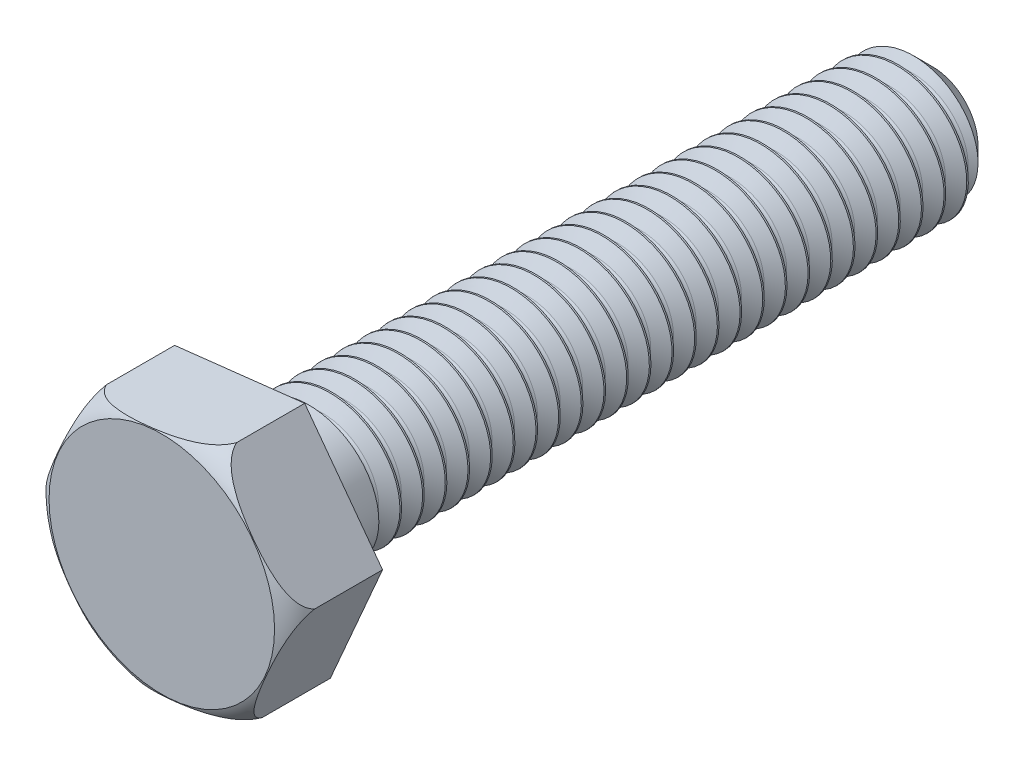
from build123d import *

# Parameters (mm, degrees)
SKETCH1_R           = 3
BOSS_EXTRUDE1_DEPTH = 30
CHAMFER1_SIZE       = 1
CUT_SWEEP1_PITCH    = 1
BOSS_EXTRUDE2_DEPTH = 4


with BuildPart() as part:
    # Sketch1 → Boss-Extrude1 (new body)
    with BuildSketch(Plane.XY):
        Circle(SKETCH1_R)
    extrude(amount=BOSS_EXTRUDE1_DEPTH)

    # Chamfer1
    chamfer1_edges = [part.edges().sort_by_distance(p)[0] for p in [
        (-3, 0, 0),
    ]]
    chamfer(chamfer1_edges, length=CHAMFER1_SIZE)

    # Cut-Sweep1: the profile of Sketch3 profile screwed along a right-hand helix of 27 turns, 8 arcs to a turn; built about Z, then put on its axis
    cut_sweep1_z = Axis((0, 0, 0), (0, 0, 1))
    cut_sweep1_corners = [(3.0003, 0, -0.000173205), (3.0003, 0, 0.930173205), (2.404596374, 0, 0.586243557), (2.334596374, 0, 0.465), (2.404596374, 0, 0.343756443)]
    with BuildLine(mode=Mode.PRIVATE) as cut_sweep1_profile:
        Line(cut_sweep1_corners[0], cut_sweep1_corners[1])
        Line(cut_sweep1_corners[1], cut_sweep1_corners[2])
        Line(cut_sweep1_corners[4], cut_sweep1_corners[0])
        ThreePointArc((2.404596374, 0, 0.586243557), (2.353352818, 0, 0.535), (2.334596374, 0, 0.465))
        ThreePointArc((2.334596374, 0, 0.465), (2.353352818, 0, 0.395), (2.404596374, 0, 0.343756443))
    cut_sweep1_cap = Face(cut_sweep1_profile.wire())
    cut_sweep1_arcs = [((2.404596374, 0, 0.586243557), (2.334596374, 0, 0.545829038), (2.334596374, 0, 0.465), (1, 0.8660254037844355, 1)), ((2.334596374, 0, 0.465), (2.334596374, 0, 0.384170962), (2.404596374, 0, 0.343756443), (1, 0.8660254037844355, 1))]  # start, shoulder, end, weights
    cut_sweep1_turn_angles = [0, 22.5, 45, 67.5, 90, 112.5, 135, 157.5, 180, 202.5, 225, 247.5, 270, 292.5, 315, 337.5, 360]
    cut_sweep1_turn_weights = [1, 0.9238795325112867, 1, 0.9238795325112867, 1, 0.9238795325112867, 1, 0.9238795325112867, 1, 0.9238795325112867, 1, 0.9238795325112867, 1, 0.9238795325112867, 1, 0.9238795325112867, 1]
    cut_sweep1_turn_rails = [Edge.make_bspline([Vector(p[0], p[1], 0).rotate(cut_sweep1_z, cut_sweep1_turn_angles[k]) / cut_sweep1_turn_weights[k] + Vector(0, 0, p[2] + CUT_SWEEP1_PITCH * cut_sweep1_turn_angles[k] / 360) for k in range(17)], [0, 0, 0, 1, 1, 2, 2, 3, 3, 4, 4, 5, 5, 6, 6, 7, 7, 8, 8, 8], 2, cut_sweep1_turn_weights) for p in cut_sweep1_corners]
    cut_sweep1_turn_sides = [*[Face.make_surface_from_curves(cut_sweep1_turn_rails[p[0]], cut_sweep1_turn_rails[p[1]]) for p in [(0, 1), (1, 2), (4, 0)]], *[Face.make_bezier_surface([[Vector(p[j][0], p[j][1], 0).rotate(cut_sweep1_z, cut_sweep1_turn_angles[2 * i + k]) / cut_sweep1_turn_weights[2 * i + k] + Vector(0, 0, p[j][2] + CUT_SWEEP1_PITCH * cut_sweep1_turn_angles[2 * i + k] / 360) for k in range(3)] for j in range(3)], [[p[3][j] * cut_sweep1_turn_weights[2 * i + k] for k in range(3)] for j in range(3)]) for p in cut_sweep1_arcs for i in range(8)]]
    cut_sweep1 = Plane(origin=(0, 0, 0), x_dir=(-1, 0, 0), z_dir=(0, 0, 1)) * Solid(Shell([*[p.moved(Location((0, 0, CUT_SWEEP1_PITCH * i))) for i in range(27) for p in cut_sweep1_turn_sides], cut_sweep1_cap, cut_sweep1_cap.rotate(cut_sweep1_z, 9720).moved(Location((0, 0, CUT_SWEEP1_PITCH * 9720 / 360)))]))
    add(cut_sweep1, mode=Mode.SUBTRACT)

    # Sketch4 → Boss-Extrude2 (add)
    with BuildSketch(Plane.XY.offset(30)):
        Polygon((-5.736404342, -0.653451264), (-2.302296776, -5.294597519), (3.434107566, -4.641146255), (5.736404342, 0.653451264), (2.302296776, 5.294597519), (-3.434107566, 4.641146255), align=None)
    extrude(amount=BOSS_EXTRUDE2_DEPTH)

    # Sketch7 → Cut-Revolve1 (revolve, cut)
    with BuildSketch(Plane(origin=(0, 0, 0), x_dir=(0.9935743773641322, 0.11318107900827326, 0), z_dir=(-0.11318107900827326, 0.9935743773641322, 0)), mode=Mode.PRIVATE) as cut_revolve1_sk:
        with BuildLine():
            Line((-5.773502692, -34), (-4.973502692, -34))
            add(Edge.make_bspline(
                [(-4.973502692, -34), (-5.616296389, -33.702579084), (-5.773502692, -33)],
                knots=[0, 0, 0, 1, 1, 1], degree=2))
            Line((-5.773502692, -33), (-5.773502692, -34))
        make_face()
    revolve(cut_revolve1_sk.sketch.rotate(Axis((0, 0, 34), (0, 0, -1)), 6.498723568), axis=Axis((0, 0, 34), (0, 0, -1)), mode=Mode.SUBTRACT)


solid = part.part
